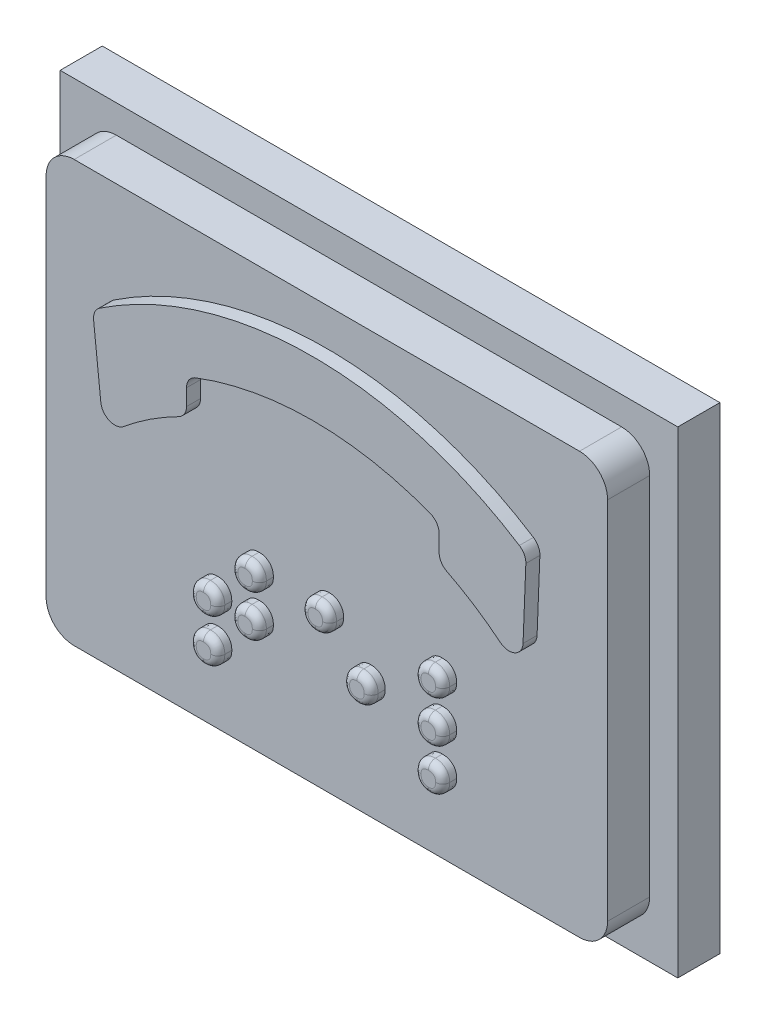
from build123d import *

# Parameters (mm, degrees)
SKETCH2_W           = 44
SKETCH2_H           = 34
BOSS_EXTRUDE1_DEPTH = 3
BOSS_EXTRUDE2_START = 3
SKETCH3_W           = 40
SKETCH3_H           = 30
BOSS_EXTRUDE2_DEPTH = 3
FILLET1_R           = 2
BOSS_EXTRUDE3_START = 6
BOSS_EXTRUDE3_DEPTH = 1
FILLET3_R           = 1
FILLET5_R           = 0.5


with BuildPart() as part:
    # Sketch2 → Boss-Extrude1 (new body)
    with BuildSketch(Plane.XY):
        Rectangle(SKETCH2_W, SKETCH2_H)
    extrude(amount=BOSS_EXTRUDE1_DEPTH)

    # Sketch3 → Boss-Extrude2 (add)
    with BuildSketch(Plane.XY.offset(BOSS_EXTRUDE2_START)):
        Rectangle(SKETCH3_W, SKETCH3_H)
    extrude(amount=BOSS_EXTRUDE2_DEPTH)

    # Fillet1
    fillet1_edges = [part.edges().sort_by_distance(p)[0] for p in [
        (-20, -15, 4.5),
        (20, -15, 4.5),
        (20, 15, 4.5),
        (-20, 15, 4.5),
    ]]
    fillet(fillet1_edges, radius=FILLET1_R)

    # Sketch4 → Boss-Extrude3 (add)
    with BuildSketch(Plane.XY.offset(BOSS_EXTRUDE3_START)):
        with BuildLine():
            Line((-15.681113072, 7.394899779), (-14.893111798, 0))
            ThreePointArc((-14.893111798, 0), (-12.123374759, 2.315558422), (-9, 4.126023607))
            Line((-9, 4.126023607), (-9, 6.59364477))
            ThreePointArc((-9, 6.59364477), (0, 8.394133762), (9, 6.59364477))
            Line((9, 6.59364477), (9, 4.126023607))
            ThreePointArc((9, 4.126023607), (12.123374759, 2.315558422), (14.893111798, 0))
            Line((14.893111798, 0), (15.197911506, 7.725587542))
            ThreePointArc((15.197911506, 7.725587542), (-0.292761912, 12.33757732), (-15.681113072, 7.394899779))
        make_face()
        with BuildLine():
            add(Edge.make_bspline(
                [(-7.787971045, -7.644037131), (-7.714818408, -7.641006356), (-7.574191689, -7.635180074), (-7.373944549, -7.581976669), (-7.197277487, -7.492312916), (-7.044778368, -7.369211666), (-6.921482925, -7.216819068), (-6.831513783, -7.039545673), (-6.778309361, -6.839297811), (-6.772483225, -6.698671195), (-6.769452526, -6.625518612)],
                knots=[0, 0, 0, 0, 1.081590891, 2.079222086, 3.040413915, 3.994979051, 4.959586085, 5.920777914, 6.918409109, 8, 8, 8, 8], degree=3))
            add(Edge.make_bspline(
                [(-6.769452526, -6.625518612), (-6.772473897, -6.552357701), (-6.7782821, -6.411715075), (-6.831611527, -6.211578819), (-6.920960234, -6.034239589), (-7.045777483, -5.883325051), (-7.196692021, -5.758507801), (-7.374031251, -5.669159095), (-7.574167508, -5.615829668), (-7.714810133, -5.610021464), (-7.787971045, -5.607000094)],
                knots=[0, 0, 0, 0, 1.081731062, 2.079491548, 3.040807945, 4, 4.959192055, 5.920508452, 6.918268938, 8, 8, 8, 8], degree=3))
            add(Edge.make_bspline(
                [(-7.787971045, -5.607000094), (-7.861123628, -5.610030793), (-8.001750243, -5.615856929), (-8.201998105, -5.669061351), (-8.3792715, -5.759030493), (-8.531664098, -5.882325936), (-8.654765348, -6.034825054), (-8.744429101, -6.211492117), (-8.797632506, -6.411739256), (-8.803458788, -6.552365975), (-8.806489563, -6.625518612)],
                knots=[0, 0, 0, 0, 1.081590891, 2.079222086, 3.040413915, 4.005020949, 4.959586085, 5.920777914, 6.918409109, 8, 8, 8, 8], degree=3))
            add(Edge.make_bspline(
                [(-8.806489563, -6.625518612), (-8.803498212, -6.698678375), (-8.797766795, -6.838852236), (-8.744419067, -7.038149343), (-8.654730037, -7.213411201), (-8.531557496, -7.364370422), (-8.37925772, -7.486570091), (-8.201164129, -7.573895173), (-8.002102442, -7.630885035), (-7.861197539, -7.63953951), (-7.787971045, -7.644037131)],
                knots=[0, 0, 0, 0, 1.084411773, 2.077729347, 3.035051784, 3.986547887, 4.949182372, 5.909658213, 6.913675829, 8, 8, 8, 8], degree=3))
        make_face()
        with BuildLine():
            add(Edge.make_bspline(
                [(-7.787971045, -10.699592686), (-7.75081358, -10.698721547), (-7.67771048, -10.697007679), (-7.570861364, -10.684686243), (-7.47019137, -10.660168967), (-7.373909455, -10.631129928), (-7.284533742, -10.589486037), (-7.199200226, -10.542212595), (-7.121116017, -10.483584294), (-7.024881515, -10.394978523), (-6.920913263, -10.266325663), (-6.831292963, -10.085849043), (-6.778478878, -9.882233615), (-6.772533936, -9.739264335), (-6.769452526, -9.665159816)],
                knots=[0, 0, 0, 0, 0.81835059, 1.610012048, 2.362225946, 3.097762334, 3.820225946, 4.528898561, 5.242566637, 5.964092999, 7.407028486, 8.855580653, 10.370169581, 12, 12, 12, 12], degree=3))
            add(Edge.make_bspline(
                [(-6.769452526, -9.665159816), (-6.770243109, -9.627504644), (-6.771788702, -9.553888681), (-6.785112705, -9.446402213), (-6.806458537, -9.345098597), (-6.836974281, -9.249317179), (-6.877767651, -9.160611031), (-6.924950982, -9.076438346), (-6.984603212, -9.001577785), (-7.06975611, -8.906780415), (-7.198189267, -8.808692801), (-7.374104963, -8.721371354), (-7.574638605, -8.672239276), (-7.714888474, -8.665873027), (-7.787971045, -8.662555649)],
                knots=[0, 0, 0, 0, 0.840263727, 1.642717874, 2.413349737, 3.148662991, 3.880975921, 4.58997358, 5.296187312, 6.012340175, 7.431356617, 8.870804444, 10.36941269, 12, 12, 12, 12], degree=3))
            add(Edge.make_bspline(
                [(-7.787971045, -8.662555649), (-7.861049948, -8.665879312), (-8.001292779, -8.672257621), (-8.201875304, -8.721305933), (-8.377959565, -8.809097677), (-8.507187848, -8.906577711), (-8.59304939, -9.001047892), (-8.650456655, -9.077411236), (-8.700346118, -9.159722978), (-8.738454885, -9.249781286), (-8.769645557, -9.345020106), (-8.790783367, -9.446424508), (-8.804165729, -9.553882702), (-8.805703156, -9.627502621), (-8.806489563, -9.665159816)],
                knots=[0, 0, 0, 0, 1.630168021, 3.128390914, 4.567468603, 5.994625999, 6.71059471, 7.410117221, 8.124385387, 8.852146656, 9.587270832, 10.357704535, 11.159952338, 12, 12, 12, 12], degree=3))
            add(Edge.make_bspline(
                [(-8.806489563, -9.665159816), (-8.803411474, -9.739251346), (-8.797492344, -9.881728533), (-8.745113392, -10.084238103), (-8.6542738, -10.261764763), (-8.532187374, -10.415463786), (-8.379299972, -10.539128249), (-8.201304407, -10.627911122), (-8.002325014, -10.686820037), (-7.861228375, -10.695227523), (-7.787971045, -10.699592686)],
                knots=[0, 0, 0, 0, 1.090206289, 2.096454564, 3.052716011, 4.007921457, 4.967580591, 5.923842038, 6.922059432, 8, 8, 8, 8], degree=3))
        make_face()
        with BuildLine():
            add(Edge.make_bspline(
                [(-4.825008082, -4.681074168), (-4.751855445, -4.678043393), (-4.611228726, -4.672217111), (-4.410981586, -4.619013706), (-4.234314524, -4.529349953), (-4.081815405, -4.406248703), (-3.958519962, -4.253856105), (-3.86855082, -4.07658271), (-3.815346398, -3.876334848), (-3.809520262, -3.735708232), (-3.806489563, -3.662555649)],
                knots=[0, 0, 0, 0, 1.081590891, 2.079222086, 3.040413915, 3.994979051, 4.959586085, 5.920777914, 6.918409109, 8, 8, 8, 8], degree=3))
            add(Edge.make_bspline(
                [(-3.806489563, -3.662555649), (-3.809510934, -3.589394738), (-3.815319137, -3.448752112), (-3.868648564, -3.248615856), (-3.957997271, -3.071276626), (-4.08281452, -2.920362088), (-4.233729058, -2.795544838), (-4.411068288, -2.706196132), (-4.611204545, -2.652866705), (-4.75184717, -2.647058501), (-4.825008082, -2.644037131)],
                knots=[0, 0, 0, 0, 1.081731062, 2.079491548, 3.040807945, 4, 4.959192055, 5.920508452, 6.918268938, 8, 8, 8, 8], degree=3))
            add(Edge.make_bspline(
                [(-4.825008082, -2.644037131), (-4.898160665, -2.64706783), (-5.03878728, -2.652893966), (-5.239035142, -2.706098388), (-5.416308537, -2.79606753), (-5.568701135, -2.919362973), (-5.691802385, -3.071862092), (-5.781466138, -3.248529154), (-5.834669543, -3.448776293), (-5.840495825, -3.589403012), (-5.8435266, -3.662555649)],
                knots=[0, 0, 0, 0, 1.081590891, 2.079222086, 3.040413915, 4.005020949, 4.959586085, 5.920777914, 6.918409109, 8, 8, 8, 8], degree=3))
            add(Edge.make_bspline(
                [(-5.8435266, -3.662555649), (-5.840535249, -3.735715412), (-5.834803832, -3.875889273), (-5.781456104, -4.07518638), (-5.691767074, -4.250448238), (-5.568594533, -4.401407459), (-5.416294757, -4.523607128), (-5.238201166, -4.61093221), (-5.039139479, -4.667922072), (-4.898234576, -4.676576547), (-4.825008082, -4.681074168)],
                knots=[0, 0, 0, 0, 1.084411773, 2.077729347, 3.035051784, 3.986547887, 4.949182372, 5.909658213, 6.913675829, 8, 8, 8, 8], degree=3))
        make_face()
        with BuildLine():
            add(Edge.make_bspline(
                [(-4.825008082, -7.644037131), (-4.751855445, -7.641006356), (-4.611228726, -7.635180074), (-4.410981586, -7.581976669), (-4.234314524, -7.492312916), (-4.081815405, -7.369211666), (-3.958519962, -7.216819068), (-3.86855082, -7.039545673), (-3.815346398, -6.839297811), (-3.809520262, -6.698671195), (-3.806489563, -6.625518612)],
                knots=[0, 0, 0, 0, 1.081590891, 2.079222086, 3.040413915, 3.994979051, 4.959586085, 5.920777914, 6.918409109, 8, 8, 8, 8], degree=3))
            add(Edge.make_bspline(
                [(-3.806489563, -6.625518612), (-3.809510934, -6.552357701), (-3.815319137, -6.411715075), (-3.868648564, -6.211578819), (-3.957997271, -6.034239589), (-4.08281452, -5.883325051), (-4.233729058, -5.758507801), (-4.411068288, -5.669159095), (-4.611204545, -5.615829668), (-4.75184717, -5.610021464), (-4.825008082, -5.607000094)],
                knots=[0, 0, 0, 0, 1.081731062, 2.079491548, 3.040807945, 4, 4.959192055, 5.920508452, 6.918268938, 8, 8, 8, 8], degree=3))
            add(Edge.make_bspline(
                [(-4.825008082, -5.607000094), (-4.898160665, -5.610030793), (-5.03878728, -5.615856929), (-5.239035142, -5.669061351), (-5.416308537, -5.759030493), (-5.568701135, -5.882325936), (-5.691802385, -6.034825054), (-5.781466138, -6.211492117), (-5.834669543, -6.411739256), (-5.840495825, -6.552365975), (-5.8435266, -6.625518612)],
                knots=[0, 0, 0, 0, 1.081590891, 2.079222086, 3.040413915, 4.005020949, 4.959586085, 5.920777914, 6.918409109, 8, 8, 8, 8], degree=3))
            add(Edge.make_bspline(
                [(-5.8435266, -6.625518612), (-5.840535249, -6.698678375), (-5.834803832, -6.838852236), (-5.781456104, -7.038149343), (-5.691767074, -7.213411201), (-5.568594533, -7.364370422), (-5.416294757, -7.486570091), (-5.238201166, -7.573895173), (-5.039139479, -7.630885035), (-4.898234576, -7.63953951), (-4.825008082, -7.644037131)],
                knots=[0, 0, 0, 0, 1.084411773, 2.077729347, 3.035051784, 3.986547887, 4.949182372, 5.909658213, 6.913675829, 8, 8, 8, 8], degree=3))
        make_face()
        with BuildLine():
            add(Edge.make_bspline(
                [(3.137954881, -7.644037131), (3.211107518, -7.641006356), (3.351734237, -7.635180074), (3.551981377, -7.581976669), (3.728648439, -7.492312916), (3.881147558, -7.369211666), (4.004443001, -7.216819068), (4.094412143, -7.039545673), (4.147616565, -6.839297811), (4.153442701, -6.698671195), (4.1564734, -6.625518612)],
                knots=[0, 0, 0, 0, 1.081590891, 2.079222086, 3.040413915, 3.994979051, 4.959586085, 5.920777914, 6.918409109, 8, 8, 8, 8], degree=3))
            add(Edge.make_bspline(
                [(4.1564734, -6.625518612), (4.153452029, -6.552357701), (4.147643826, -6.411715075), (4.094314399, -6.211578819), (4.004965692, -6.034239589), (3.880148443, -5.883325051), (3.729233905, -5.758507801), (3.551894675, -5.669159095), (3.351758418, -5.615829668), (3.211115793, -5.610021464), (3.137954881, -5.607000094)],
                knots=[0, 0, 0, 0, 1.081731062, 2.079491548, 3.040807945, 4, 4.959192055, 5.920508452, 6.918268938, 8, 8, 8, 8], degree=3))
            add(Edge.make_bspline(
                [(3.137954881, -5.607000094), (3.064802298, -5.610030793), (2.924175683, -5.615856929), (2.723927821, -5.669061351), (2.546654426, -5.759030493), (2.394261828, -5.882325936), (2.271160578, -6.034825054), (2.181496825, -6.211492117), (2.128293419, -6.411739256), (2.122467137, -6.552365975), (2.119436363, -6.625518612)],
                knots=[0, 0, 0, 0, 1.081590891, 2.079222086, 3.040413915, 4.005020949, 4.959586085, 5.920777914, 6.918409109, 8, 8, 8, 8], degree=3))
            add(Edge.make_bspline(
                [(2.119436363, -6.625518612), (2.122427714, -6.698678375), (2.128159131, -6.838852236), (2.181506859, -7.038149343), (2.271195889, -7.213411201), (2.39436843, -7.364370422), (2.546668206, -7.486570091), (2.724761796, -7.573895173), (2.923823484, -7.630885035), (3.064728387, -7.63953951), (3.137954881, -7.644037131)],
                knots=[0, 0, 0, 0, 1.084411773, 2.077729347, 3.035051784, 3.986547887, 4.949182372, 5.909658213, 6.913675829, 8, 8, 8, 8], degree=3))
        make_face()
        with BuildLine():
            add(Edge.make_bspline(
                [(0.174991918, -4.681074168), (0.248144555, -4.678043393), (0.388771274, -4.672217111), (0.589018414, -4.619013706), (0.765685476, -4.529349953), (0.918184595, -4.406248703), (1.041480038, -4.253856105), (1.13144918, -4.07658271), (1.184653602, -3.876334848), (1.190479738, -3.735708232), (1.193510437, -3.662555649)],
                knots=[0, 0, 0, 0, 1.081590891, 2.079222086, 3.040413915, 3.994979051, 4.959586085, 5.920777914, 6.918409109, 8, 8, 8, 8], degree=3))
            add(Edge.make_bspline(
                [(1.193510437, -3.662555649), (1.190489066, -3.589394738), (1.184680863, -3.448752112), (1.131351436, -3.248615856), (1.042002729, -3.071276626), (0.91718548, -2.920362088), (0.766270942, -2.795544838), (0.588931712, -2.706196132), (0.388795455, -2.652866705), (0.24815283, -2.647058501), (0.174991918, -2.644037131)],
                knots=[0, 0, 0, 0, 1.081731062, 2.079491548, 3.040807945, 4, 4.959192055, 5.920508452, 6.918268938, 8, 8, 8, 8], degree=3))
            add(Edge.make_bspline(
                [(0.174991918, -2.644037131), (0.101839335, -2.64706783), (-0.03878728, -2.652893966), (-0.239035142, -2.706098388), (-0.416308537, -2.79606753), (-0.568701135, -2.919362973), (-0.691802385, -3.071862092), (-0.781466138, -3.248529154), (-0.834669543, -3.448776293), (-0.840495825, -3.589403012), (-0.8435266, -3.662555649)],
                knots=[0, 0, 0, 0, 1.081590891, 2.079222086, 3.040413915, 4.005020949, 4.959586085, 5.920777914, 6.918409109, 8, 8, 8, 8], degree=3))
            add(Edge.make_bspline(
                [(-0.8435266, -3.662555649), (-0.840535249, -3.735715412), (-0.834803832, -3.875889273), (-0.781456104, -4.07518638), (-0.691767074, -4.250448238), (-0.568594533, -4.401407459), (-0.416294757, -4.523607128), (-0.238201166, -4.61093221), (-0.039139479, -4.667922072), (0.101765424, -4.676576547), (0.174991918, -4.681074168)],
                knots=[0, 0, 0, 0, 1.084411773, 2.077729347, 3.035051784, 3.986547887, 4.949182372, 5.909658213, 6.913675829, 8, 8, 8, 8], degree=3))
        make_face()
        with BuildLine():
            add(Edge.make_bspline(
                [(8.230547474, -7.644037131), (8.157320979, -7.63953951), (8.016416077, -7.630885035), (7.817354389, -7.573895173), (7.639260798, -7.486570091), (7.486961023, -7.364370422), (7.363788482, -7.213411201), (7.274099451, -7.038149343), (7.220751724, -6.838852236), (7.215020306, -6.698678375), (7.212028955, -6.625518612)],
                knots=[0, 0, 0, 0, 1.086324171, 2.090341787, 3.050817628, 4.013452113, 4.964948216, 5.922270653, 6.915588227, 8, 8, 8, 8], degree=3))
            add(Edge.make_bspline(
                [(7.212028955, -6.625518612), (7.21505973, -6.552365975), (7.220886012, -6.411739256), (7.274089418, -6.211492117), (7.36375317, -6.034825054), (7.48685442, -5.882325936), (7.639247018, -5.759030493), (7.816520414, -5.669061351), (8.016768275, -5.615856929), (8.157394891, -5.610030793), (8.230547474, -5.607000094)],
                knots=[0, 0, 0, 0, 1.081590891, 2.079222086, 3.040413915, 3.994979051, 4.959586085, 5.920777914, 6.918409109, 8, 8, 8, 8], degree=3))
            add(Edge.make_bspline(
                [(8.230547474, -5.607000094), (8.303708385, -5.610021464), (8.444351011, -5.615829668), (8.644487268, -5.669159095), (8.821826497, -5.758507801), (8.972741036, -5.883325051), (9.097558285, -6.034239589), (9.186906991, -6.211578819), (9.240236418, -6.411715075), (9.246044622, -6.552357701), (9.249065992, -6.625518612)],
                knots=[0, 0, 0, 0, 1.081731062, 2.079491548, 3.040807945, 4, 4.959192055, 5.920508452, 6.918268938, 8, 8, 8, 8], degree=3))
            add(Edge.make_bspline(
                [(9.249065992, -6.625518612), (9.246035294, -6.698671195), (9.240209157, -6.839297811), (9.187004736, -7.039545673), (9.097035593, -7.216819068), (8.973740151, -7.369211666), (8.821241032, -7.492312916), (8.64457397, -7.581976669), (8.44432683, -7.635180074), (8.303700111, -7.641006356), (8.230547474, -7.644037131)],
                knots=[0, 0, 0, 0, 1.081590891, 2.079222086, 3.040413915, 4.005020949, 4.959586085, 5.920777914, 6.918409109, 8, 8, 8, 8], degree=3))
        make_face()
        with BuildLine():
            add(Edge.make_bspline(
                [(8.230547474, -10.607000094), (8.157304975, -10.602602772), (8.016236903, -10.594133348), (7.816845338, -10.535594214), (7.639118965, -10.444963404), (7.511639723, -10.340480251), (7.424877835, -10.242327211), (7.368457569, -10.161840153), (7.318473236, -10.07684102), (7.279711427, -9.984660529), (7.249153392, -9.887291541), (7.227686262, -9.784074525), (7.214368701, -9.675154541), (7.212820616, -9.600577292), (7.212028955, -9.562439909)],
                knots=[0, 0, 0, 0, 1.60786025, 3.096805109, 4.528000998, 5.966122732, 6.686801724, 7.401221987, 8.122757309, 8.849023043, 9.59300518, 10.361922203, 11.162318244, 12, 12, 12, 12], degree=3))
            add(Edge.make_bspline(
                [(7.212028955, -9.562439909), (7.212803552, -9.524301269), (7.21430854, -9.450200501), (7.227674971, -9.342238575), (7.249180857, -9.24047116), (7.279476548, -9.144925971), (7.318161911, -9.055463135), (7.368596327, -8.974581926), (7.42454771, -8.898442435), (7.512399225, -8.807558902), (7.640482294, -8.711608898), (7.817438647, -8.628025632), (8.017056815, -8.577656495), (8.157422249, -8.572598228), (8.230547474, -8.569963057)],
                knots=[0, 0, 0, 0, 0.85343326, 1.658162449, 2.430979135, 3.178656813, 3.898784587, 4.606012532, 5.307698695, 6.010131818, 7.428619027, 8.862752615, 10.365609573, 12, 12, 12, 12], degree=3))
            add(Edge.make_bspline(
                [(8.230547474, -8.569963057), (8.303676266, -8.572591862), (8.444048547, -8.577637909), (8.643619241, -8.628091778), (8.820394104, -8.711209267), (8.94770497, -8.807755762), (9.034851, -8.898962121), (9.093029355, -8.973603263), (9.140777567, -9.056356269), (9.182144647, -9.144448338), (9.211749265, -9.24055226), (9.233466511, -9.342215678), (9.246773741, -9.450206733), (9.248287092, -9.524303387), (9.249065992, -9.562439909)],
                knots=[0, 0, 0, 0, 1.63482458, 3.138080752, 4.572595298, 5.982845691, 6.685465406, 7.393869458, 8.095742014, 8.82049882, 9.568375108, 10.341397083, 11.146340037, 12, 12, 12, 12], degree=3))
            add(Edge.make_bspline(
                [(9.249065992, -9.562439909), (9.246094681, -9.637532275), (9.240397568, -9.781512378), (9.186607736, -9.986703202), (9.098018278, -10.168956829), (8.994084938, -10.299416349), (8.89699986, -10.388088716), (8.819326041, -10.447945197), (8.73477256, -10.49756727), (8.643889181, -10.536208676), (8.548698203, -10.568174513), (8.447592998, -10.591913636), (8.340825063, -10.604462852), (8.267710675, -10.606145051), (8.230547474, -10.607000094)],
                knots=[0, 0, 0, 0, 1.642904973, 3.150062261, 4.610441591, 6.054556597, 6.772542642, 7.489049507, 8.199530265, 8.914164314, 9.649364798, 10.397887805, 11.185664814, 12, 12, 12, 12], degree=3))
        make_face()
        with BuildLine():
            add(Edge.make_bspline(
                [(8.230547474, -4.681074168), (8.157320979, -4.676576547), (8.016416077, -4.667922072), (7.817354389, -4.61093221), (7.639260798, -4.523607128), (7.486961023, -4.401407459), (7.363788482, -4.250448238), (7.274099451, -4.07518638), (7.220751724, -3.875889273), (7.215020306, -3.735715412), (7.212028955, -3.662555649)],
                knots=[0, 0, 0, 0, 1.086324171, 2.090341787, 3.050817628, 4.013452113, 4.964948216, 5.922270653, 6.915588227, 8, 8, 8, 8], degree=3))
            add(Edge.make_bspline(
                [(7.212028955, -3.662555649), (7.21505973, -3.589403012), (7.220886012, -3.448776293), (7.274089418, -3.248529154), (7.36375317, -3.071862092), (7.48685442, -2.919362973), (7.639247018, -2.79606753), (7.816520414, -2.706098388), (8.016768275, -2.652893966), (8.157394891, -2.64706783), (8.230547474, -2.644037131)],
                knots=[0, 0, 0, 0, 1.081590891, 2.079222086, 3.040413915, 3.994979051, 4.959586085, 5.920777914, 6.918409109, 8, 8, 8, 8], degree=3))
            add(Edge.make_bspline(
                [(8.230547474, -2.644037131), (8.303708385, -2.647058501), (8.444351011, -2.652866705), (8.644487268, -2.706196132), (8.821826497, -2.795544838), (8.972741036, -2.920362088), (9.097558285, -3.071276626), (9.186906991, -3.248615856), (9.240236418, -3.448752112), (9.246044622, -3.589394738), (9.249065992, -3.662555649)],
                knots=[0, 0, 0, 0, 1.081731062, 2.079491548, 3.040807945, 4, 4.959192055, 5.920508452, 6.918268938, 8, 8, 8, 8], degree=3))
            add(Edge.make_bspline(
                [(9.249065992, -3.662555649), (9.246035294, -3.735708232), (9.240209157, -3.876334848), (9.187004736, -4.07658271), (9.097035593, -4.253856105), (8.973740151, -4.406248703), (8.821241032, -4.529349953), (8.64457397, -4.619013706), (8.44432683, -4.672217111), (8.303700111, -4.678043393), (8.230547474, -4.681074168)],
                knots=[0, 0, 0, 0, 1.081590891, 2.079222086, 3.040413915, 4.005020949, 4.959586085, 5.920777914, 6.918409109, 8, 8, 8, 8], degree=3))
        make_face()
    extrude(amount=BOSS_EXTRUDE3_DEPTH)

    # Fillet3
    fillet3_edges = [part.edges().sort_by_distance(p)[0] for p in [
        (9, 6.59364477, 6.5),
        (9, 4.126023607, 6.5),
        (14.893111798, 0, 6.5),
        (15.197911506, 7.725587542, 6.5),
        (-15.681113072, 7.394899779, 6.5),
        (-14.893111798, 0, 6.5),
        (-9, 4.126023607, 6.5),
        (-9, 6.59364477, 6.5),
    ]]
    fillet(fillet3_edges, radius=FILLET3_R)

    # Fillet5
    fillet5_edges = [part.edges().sort_by_distance(p)[0] for p in [
        (0.913562877, -4.401126681, 7),
        (0.912839141, -2.924708427, 7),
        (-0.563579113, -2.923984691, 7),
        (-0.562398651, -4.397947056, 7),
        (7.491976442, -5.886947654, 7),
        (7.493156904, -7.360910019, 7),
        (8.969118432, -7.364089644, 7),
        (8.968394696, -5.88767139, 7),
        (8.973926247, -10.314879637, 7),
        (8.969784583, -8.833137074, 7),
        (7.490536437, -8.832494461, 7),
        (7.488318533, -10.31175994, 7),
        (7.491976442, -2.923984691, 7),
        (7.493156904, -4.397947056, 7),
        (8.969118432, -4.401126681, 7),
        (8.968394696, -2.924708427, 7),
        (-7.049400086, -7.364089644, 7),
        (-7.050123822, -5.88767139, 7),
        (-8.526542076, -5.886947654, 7),
        (-8.525361614, -7.360910019, 7),
        (-8.527485984, -8.93186743, 7),
        (-8.528414043, -10.4090791, 7),
        (-7.046393784, -10.41221784, 7),
        (-7.049243746, -8.932518056, 7),
        (-4.086437123, -4.401126681, 7),
        (-4.087160859, -2.924708427, 7),
        (-5.563579113, -2.923984691, 7),
        (-5.562398651, -4.397947056, 7),
        (-4.086437123, -7.364089644, 7),
        (-4.087160859, -5.88767139, 7),
        (-5.563579113, -5.886947654, 7),
        (-5.562398651, -7.360910019, 7),
        (3.87652584, -7.364089644, 7),
        (3.875802104, -5.88767139, 7),
        (2.39938385, -5.886947654, 7),
        (2.400564312, -7.360910019, 7),
    ]]
    fillet(fillet5_edges, radius=FILLET5_R)


solid = part.part
